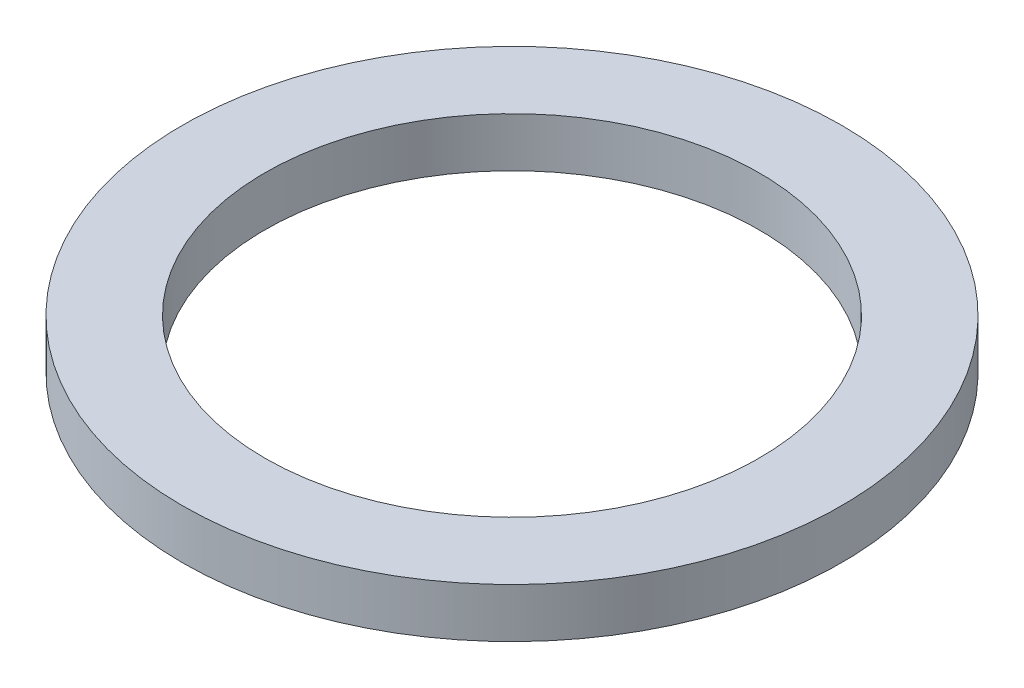
from build123d import *

# Parameters (mm, degrees)
SKETCH1_R           = 60
BOSS_EXTRUDE1_DEPTH = 9
SKETCH2_R           = 45
CUT_EXTRUDE1_DEPTH  = 86.32877592


with BuildPart() as part:
    # Sketch1 → Boss-Extrude1 (new body)
    with BuildSketch(Plane(origin=(0, 0, 0), x_dir=(1, 0, 0), z_dir=(0, 1, 0))):
        Circle(SKETCH1_R)
    extrude(amount=BOSS_EXTRUDE1_DEPTH)

    # Sketch2 → Cut-Extrude1 (cut, through all)
    with BuildSketch(Plane(origin=(0, 0, 0), x_dir=(1, 0, 0), z_dir=(0, 1, 0))):
        Circle(SKETCH2_R)
    extrude(amount=CUT_EXTRUDE1_DEPTH, mode=Mode.SUBTRACT)


solid = part.part
